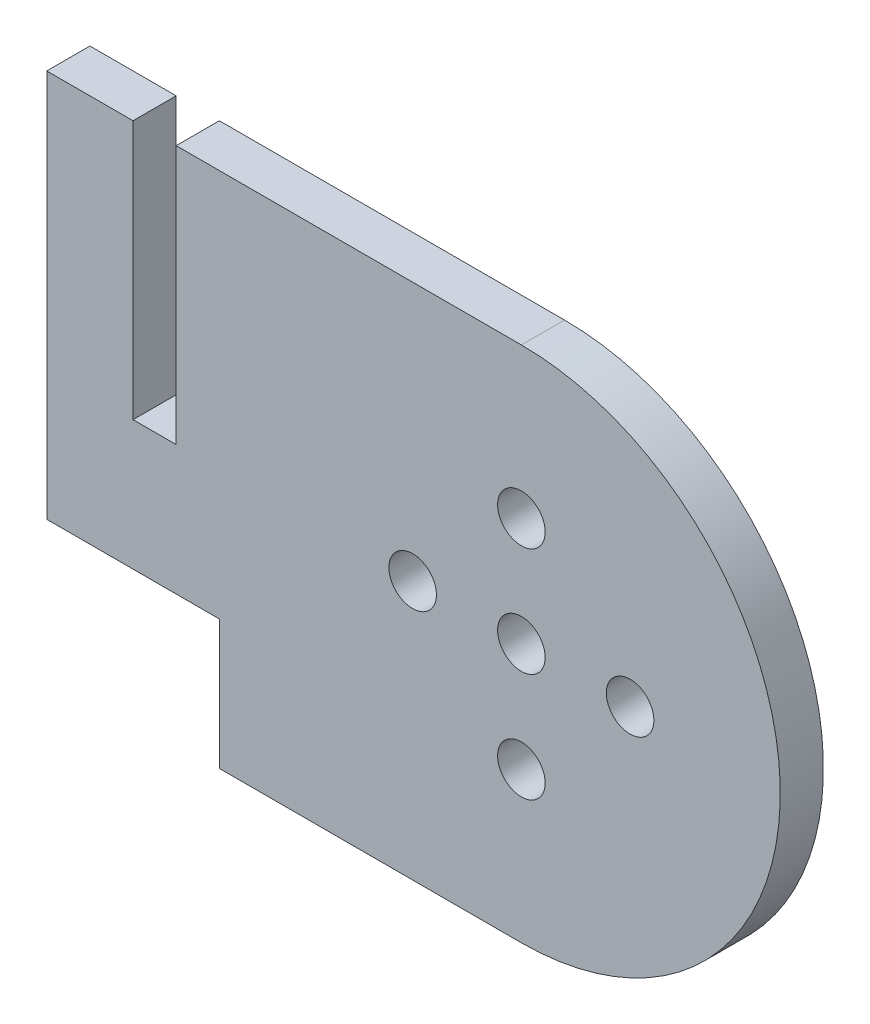
from build123d import *

# Parameters (mm, degrees)
SKETCH1_R           = 1.75
BOSS_EXTRUDE1_DEPTH = 3.175


with BuildPart() as part:
    # Sketch1 → Boss-Extrude1 (new body)
    with BuildSketch(Plane.XY):
        with BuildLine():
            Line((-6.220072382, 19.05), (19.179927618, 19.05))
            ThreePointArc((19.179927618, 19.05), (38.229927618, 0), (19.179927618, -19.05))
            Line((19.179927618, -19.05), (-3.045072382, -19.05))
            Line((-3.045072382, -19.05), (-3.045072382, -9.525))
            Line((-3.045072382, -9.525), (-15.745072382, -9.525))
            Line((-15.745072382, -9.525), (-15.745072382, 19.05))
            Line((-15.745072382, 19.05), (-9.395072382, 19.05))
            Line((-9.395072382, 19.05), (-9.395072382, 0))
            Line((-9.395072382, 0), (-6.220072382, 0))
            Line((-6.220072382, 0), (-6.220072382, 19.05))
        make_face()
        with Locations((19.179927618, 8)):
            Circle(SKETCH1_R, mode=Mode.SUBTRACT)
        with Locations((19.179927618, 0)):
            Circle(SKETCH1_R, mode=Mode.SUBTRACT)
        with Locations((27.179927618, 0)):
            Circle(SKETCH1_R, mode=Mode.SUBTRACT)
        with Locations((19.179927618, -8)):
            Circle(SKETCH1_R, mode=Mode.SUBTRACT)
        with Locations((11.179927618, 0)):
            Circle(SKETCH1_R, mode=Mode.SUBTRACT)
    extrude(amount=BOSS_EXTRUDE1_DEPTH)


solid = part.part
